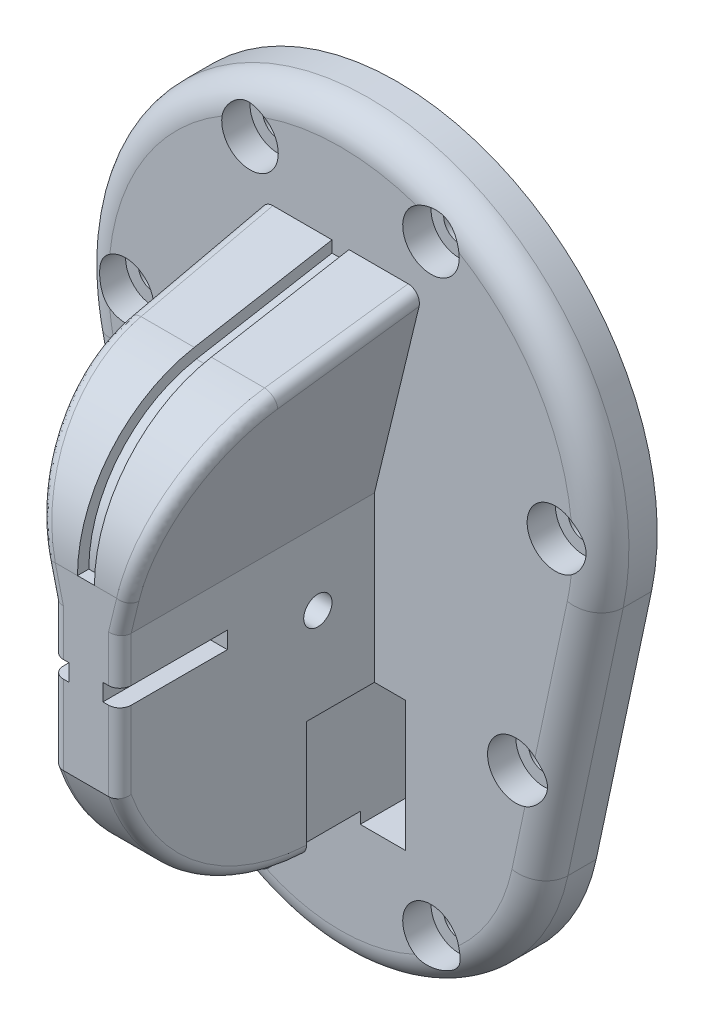
from build123d import *

# Parameters (mm, degrees)
BOSS_EXTRU_2_DEPTH      = 10
CONG_1_R                = 5
PER_AGE1_D              = 5.5
PER_AGE1_DEPTH          = 10
PER_AGE1_CBORE_D        = 10
PER_AGE1_CBORE_DEPTH    = 5
PER_AGE1_TIP            = 1.652366702
ESQUISSE4_W             = 8
ESQUISSE4_H             = 23
ENL_V_MAT_EXTRU_1_DEPTH = 97.291225083
BOSS_EXTRU_5_DEPTH      = 45
ESQUISSE6_R             = 2.5
ENL_V_MAT_EXTRU_2_DEPTH = 22.5
ESQUISSE7_W             = 2.5
ESQUISSE7_H             = 21
ENL_V_MAT_EXTRU_3_DEPTH = 12
CONG_2_R                = 2
ENL_V_MAT_EXTRU_4_DEPTH = 1.5
ESQUISSE9_W             = 19
ESQUISSE9_H             = 3
ENL_V_MAT_EXTRU_5_DEPTH = 3
ESQUISSE11_W            = 14
ESQUISSE11_H            = 29
ENL_V_MAT_EXTRU_6_DEPTH = 4


with BuildPart() as part:
    # Esquisse1 → Boss.-Extru.2 (new body)
    with BuildSketch(Plane.XY):
        with BuildLine():
            Line((-44.990662612, -9.583333333), (-35.210083783, -55.5))
            ThreePointArc((-35.210083783, -55.5), (0, -84), (35.210083783, -55.5))
            Line((35.210083783, -55.5), (44.990662612, -9.583333333))
            ThreePointArc((44.990662612, -9.583333333), (0, 46), (-44.990662612, -9.583333333))
        make_face()
    extrude(amount=BOSS_EXTRU_2_DEPTH)

    # Congé1
    cong_1_edges = [part.edges().sort_by_distance(p)[0] for p in [
        (0, -84, 10),
        (40.100373197, -32.541666667, 10),
        (0, 46, 10),
        (-40.100373197, -32.541666667, 10),
    ]]
    fillet(cong_1_edges, radius=CONG_1_R)

    # Perçage1
    with Locations(Plane.XY.offset(10)):
        with Locations((38, 0), (16, 34.467375879), (-16, 34.467375879), (-38, 0), (-31, -39), (-16, -72), (16, -72), (31, -39)):
            CounterBoreHole(PER_AGE1_D / 2, PER_AGE1_CBORE_D / 2, PER_AGE1_CBORE_DEPTH, depth=PER_AGE1_DEPTH)
            with Locations((0, 0, -(PER_AGE1_DEPTH + PER_AGE1_TIP / 2))):  # 118° drill point
                Cone(0, PER_AGE1_D / 2, PER_AGE1_TIP, mode=Mode.SUBTRACT)

    # Esquisse4 → Enlèv. mat.-Extru.1 (cut, through all)
    with BuildSketch(Plane.XY):
        with Locations((-7.5, -49.5)):
            Rectangle(ESQUISSE4_W, ESQUISSE4_H)
        with Locations((7.5, -49.5)):
            Rectangle(ESQUISSE4_W, ESQUISSE4_H)
    extrude(amount=ENL_V_MAT_EXTRU_1_DEPTH, mode=Mode.SUBTRACT)

    # Esquisse5 → Boss.-Extru.5 (add)
    with BuildSketch(Plane.XY.offset(10)):
        Polygon((-6, -59), (6, -59), (6, -9), (14.5, 26), (-14.5, 26), (-6, -9), align=None)
    extrude(amount=BOSS_EXTRU_5_DEPTH)

    # Esquisse6 → Enlèv. mat.-Extru.2 (cut, symmetric)
    with BuildSketch(Plane(origin=(0, 0, 0), x_dir=(0, 0, -1), z_dir=(1, 0, 0))):
        with Locations((-20, -22)):
            Circle(ESQUISSE6_R)
        with BuildLine():
            Line((-20, -59), (-55, -59))
            Line((-55, -59), (-55, -34))
            ThreePointArc((-55, -34), (-41.505813168, -52.108138435), (-20, -59))
        make_face()
        with BuildLine():
            Line((-10, 26), (-34.341204442, 21.707988914))
            ThreePointArc((-34.341204442, 21.707988914), (-49.151111078, 13.157485331), (-55, -2.912204911))
            Line((-55, -2.912204911), (-55, 26))
            Line((-55, 26), (-10, 26))
        make_face()
    extrude(amount=ENL_V_MAT_EXTRU_2_DEPTH, both=True, mode=Mode.SUBTRACT)

    # Esquisse7 → Enlèv. mat.-Extru.3 (cut)
    with BuildSketch(Plane(origin=(0, 0, 10), x_dir=(-1, 0, 0), z_dir=(0, 0, -1))):
        with Locations((4.75, -48.5)):
            Rectangle(ESQUISSE7_W, ESQUISSE7_H)
        with Locations((-4.75, -48.5)):
            Rectangle(ESQUISSE7_W, ESQUISSE7_H)
    extrude(amount=-ENL_V_MAT_EXTRU_3_DEPTH, mode=Mode.SUBTRACT)

    # Congé2
    cong_2_edges = [part.edges().sort_by_distance(p)[0] for p in [
        (-6, -21.5, 55),
        (6.739232261, -5.956102456, 55),
        (6, -21.5, 55),
        (-6.739232261, -5.956102456, 55),
        (-13.978827225, 23.853994457, 22.170602221),
        (6, -51.515681229, 42.311982466),
        (13.978827225, 23.853994457, 22.170602221),
        (11.38110358, 13.157485331, 49.151111078),
        (-11.38110358, 13.157485331, 49.151111078),
        (-6, -51.515681229, 42.311982466),
    ]]
    fillet(cong_2_edges, radius=CONG_2_R - 0.0001)  # a hair under: the kernel refuses the full size

    # Esquisse8 → Enlèv. mat.-Extru.4 (cut, symmetric)
    with BuildSketch(Plane(origin=(0, 0, 0), x_dir=(0, 0, -1), z_dir=(1, 0, 0))):
        with BuildLine():
            Line((-10, 26), (-34.341204442, 21.707988914))
            ThreePointArc((-34.341204442, 21.707988914), (-49.151111078, 13.157485331), (-55, -2.912204911))
            Line((-55, -2.912204911), (-53, -2.912204911))
            ThreePointArc((-53, -2.912204911), (-47.619022192, 11.871910111), (-33.993908086, 19.738373408))
            Line((-33.993908086, 19.738373408), (-10, 23.969146776))
            Line((-10, 23.969146776), (-10, 26))
        make_face()
    extrude(amount=ENL_V_MAT_EXTRU_4_DEPTH, both=True, mode=Mode.SUBTRACT)

    # Esquisse9 → Enlèv. mat.-Extru.5 (cut)
    with BuildSketch(Plane.ZY.offset(6)):
        with Locations((45.5, -18.5)):
            Rectangle(ESQUISSE9_W, ESQUISSE9_H)
    enl_v_mat_extru_5 = extrude(amount=-ENL_V_MAT_EXTRU_5_DEPTH, mode=Mode.SUBTRACT)

    # Symétrie1: Enlèv. mat.-Extru.5 across plane
    add(enl_v_mat_extru_5.mirror(Plane(origin=(0, 0, 0), x_dir=(0, 0, 1), z_dir=(1, 0, 0))), mode=Mode.SUBTRACT)

    # Esquisse11 → Enlèv. mat.-Extru.6 (cut)
    with BuildSketch(Plane(origin=(0, 0, 0), x_dir=(-1, 0, 0), z_dir=(0, 0, -1))):
        with BuildLine():
            Line((36.186282213, -36.517062866), (42.056488963, -8.958333333))
            ThreePointArc((42.056488963, -8.958333333), (42.578900793, -6.003099808), (42.893914474, -3.018625701))
            ThreePointArc((42.893914474, -3.018625701), (32.25, 0), (42.893914474, 3.018625701))
            ThreePointArc((42.893914474, 3.018625701), (36.245870908, 23.135186235), (20.798598375, 37.635333207))
            ThreePointArc((20.798598375, 37.635333207), (13.578947368, 29.251917687), (15.32259276, 40.177333798))
            ThreePointArc((15.32259276, 40.177333798), (0, 43), (-15.32259276, 40.177333798))
            ThreePointArc((-15.32259276, 40.177333798), (-13.578947368, 29.251917687), (-20.798598375, 37.635333207))
            ThreePointArc((-20.798598375, 37.635333207), (-36.245870908, 23.135186235), (-42.893914474, 3.018625701))
            ThreePointArc((-42.893914474, 3.018625701), (-32.25, 0), (-42.893914474, -3.018625701))
            ThreePointArc((-42.893914474, -3.018625701), (-42.578900793, -6.003099808), (-42.056488963, -8.958333333))
            Line((-42.056488963, -8.958333333), (-36.186282213, -36.517062866))
            ThreePointArc((-36.186282213, -36.517062866), (-25.376167174, -37.802083333), (-34.724227339, -43.38093948))
            Line((-34.724227339, -43.38093948), (-32.275910134, -54.875))
            ThreePointArc((-32.275910134, -54.875), (-28.441184093, -64.736159875), (-21.682746169, -72.876867137))
            ThreePointArc((-21.682746169, -72.876867137), (-12.810473872, -67.215710808), (-14.623744215, -77.58286844))
            ThreePointArc((-14.623744215, -77.58286844), (0, -81), (14.623744215, -77.58286844))
            ThreePointArc((14.623744215, -77.58286844), (12.810473872, -67.215710808), (21.682746169, -72.876867137))
            ThreePointArc((21.682746169, -72.876867137), (28.441184093, -64.736159875), (32.275910134, -54.875))
            Line((32.275910134, -54.875), (34.724227339, -43.38093948))
            ThreePointArc((34.724227339, -43.38093948), (25.376167174, -37.802083333), (36.186282213, -36.517062866))
        make_face()
        with Locations((7.5, -49.5)):
            Rectangle(ESQUISSE11_W, ESQUISSE11_H, mode=Mode.SUBTRACT)
        with Locations((-7.5, -49.5)):
            Rectangle(ESQUISSE11_W, ESQUISSE11_H, mode=Mode.SUBTRACT)
    extrude(amount=-ENL_V_MAT_EXTRU_6_DEPTH, mode=Mode.SUBTRACT)


solid = part.part
